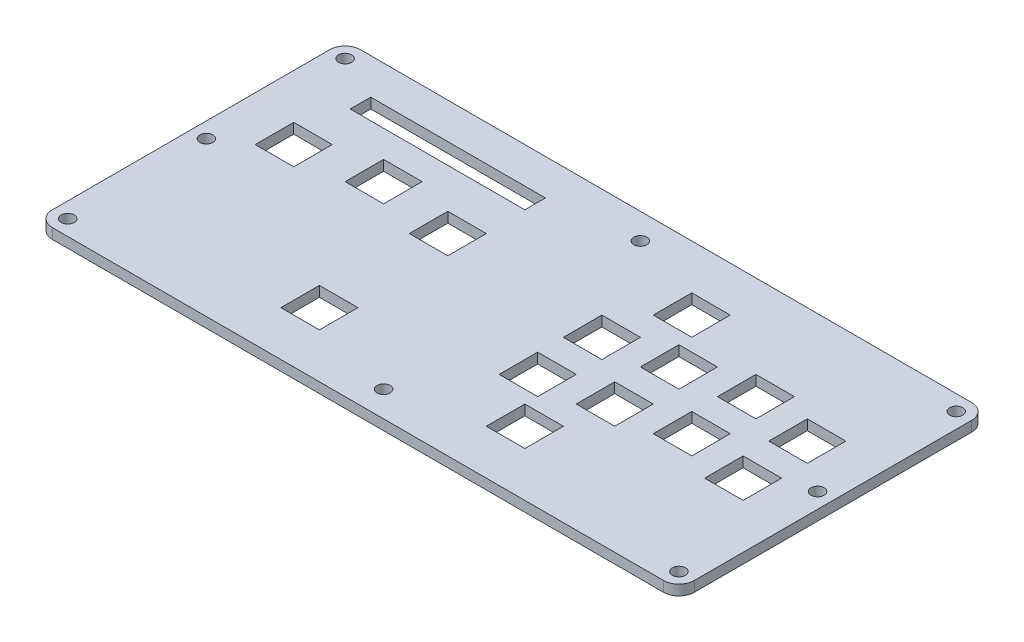
from build123d import *

# Parameters (mm, degrees)
SKETCH_1_R      = 2.55
SKETCH_1_W      = 15
SKETCH_1_H      = 15
EXTRUDE_1_DEPTH = 4


with BuildPart() as part:
    # 草图1 → 凸台-拉伸1 (new body)
    with BuildSketch(Plane(origin=(0, 0, 0), x_dir=(1, 0, 0), z_dir=(0, 1, 0))):
        with BuildLine():
            Line((264.727612051, 134.040577206), (26.727612051, 134.040577206))
            ThreePointArc((26.727612051, 134.040577206), (22.484971363, 132.283217894), (20.727612051, 128.040577206))
            Line((20.727612051, 128.040577206), (20.727612051, 20.040577206))
            ThreePointArc((20.727612051, 20.040577206), (22.484971363, 15.797936519), (26.727612051, 14.040577206))
            Line((26.727612051, 14.040577206), (264.727612051, 14.040577206))
            ThreePointArc((264.727612051, 14.040577206), (268.970252738, 15.797936519), (270.727612051, 20.040577206))
            Line((270.727612051, 20.040577206), (270.727612051, 128.040577206))
            ThreePointArc((270.727612051, 128.040577206), (268.970252738, 132.283217894), (264.727612051, 134.040577206))
        make_face()
        with Locations((26.727612051, 20.040577206)):
            Circle(SKETCH_1_R, mode=Mode.SUBTRACT)
        with Locations((105.727612051, 39.040577206)):
            Rectangle(SKETCH_1_W, SKETCH_1_H, mode=Mode.SUBTRACT)
        with Locations((145.727612051, 24.040577206)):
            Circle(SKETCH_1_R, mode=Mode.SUBTRACT)
        with Locations((185.727612051, 39.040577206)):
            Rectangle(SKETCH_1_W, SKETCH_1_H, mode=Mode.SUBTRACT)
        with Locations((264.727612051, 20.040577206)):
            Circle(SKETCH_1_R, mode=Mode.SUBTRACT)
        with Locations((170.727612051, 59.040577206)):
            Rectangle(SKETCH_1_W, SKETCH_1_H, mode=Mode.SUBTRACT)
        with Locations((195.727612051, 64.040577206)):
            Rectangle(SKETCH_1_W, SKETCH_1_H, mode=Mode.SUBTRACT)
        with Locations((220.727612051, 69.040577206)):
            Rectangle(SKETCH_1_W, SKETCH_1_H, mode=Mode.SUBTRACT)
        with Locations((245.727612051, 64.040577206)):
            Rectangle(SKETCH_1_W, SKETCH_1_H, mode=Mode.SUBTRACT)
        with Locations((26.727612051, 74.040577206)):
            Circle(SKETCH_1_R, mode=Mode.SUBTRACT)
        with Locations((45.727612051, 89.040577206)):
            Rectangle(SKETCH_1_W, SKETCH_1_H, mode=Mode.SUBTRACT)
        with Locations((75.727612051, 94.040577206)):
            Rectangle(SKETCH_1_W, SKETCH_1_H, mode=Mode.SUBTRACT)
        with Locations((105.727612051, 89.040577206)):
            Rectangle(SKETCH_1_W, SKETCH_1_H, mode=Mode.SUBTRACT)
        Polygon((44.727612051, 112.040577206), (44.727612051, 116.040577206), (44.727612051, 120.040577206), (112.727612051, 120.040577206), (112.727612051, 112.040577206), align=None, mode=Mode.SUBTRACT)
        with Locations((26.727612051, 128.040577206)):
            Circle(SKETCH_1_R, mode=Mode.SUBTRACT)
        with Locations((170.727612051, 84.040577206)):
            Rectangle(SKETCH_1_W, SKETCH_1_H, mode=Mode.SUBTRACT)
        with Locations((195.727612051, 89.040577206)):
            Rectangle(SKETCH_1_W, SKETCH_1_H, mode=Mode.SUBTRACT)
        with Locations((264.727612051, 74.040577206)):
            Circle(SKETCH_1_R, mode=Mode.SUBTRACT)
        with Locations((220.727612051, 94.040577206)):
            Rectangle(SKETCH_1_W, SKETCH_1_H, mode=Mode.SUBTRACT)
        with Locations((245.727612051, 89.040577206)):
            Rectangle(SKETCH_1_W, SKETCH_1_H, mode=Mode.SUBTRACT)
        with Locations((180.727612051, 109.040577206)):
            Rectangle(SKETCH_1_W, SKETCH_1_H, mode=Mode.SUBTRACT)
        with Locations((145.727612051, 124.040577206)):
            Circle(SKETCH_1_R, mode=Mode.SUBTRACT)
        with Locations((264.727612051, 128.040577206)):
            Circle(SKETCH_1_R, mode=Mode.SUBTRACT)
    extrude(amount=EXTRUDE_1_DEPTH)


solid = part.part
